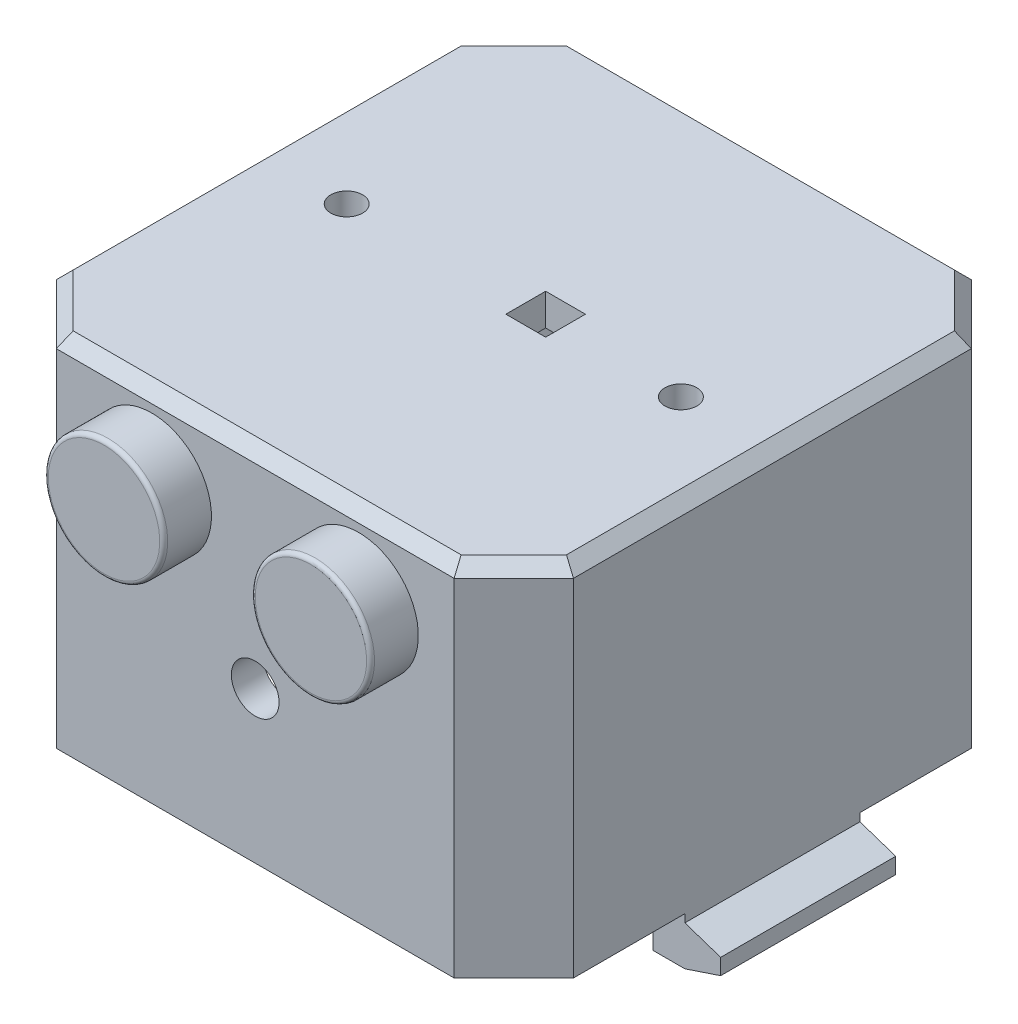
from build123d import *

# Parameters (mm, degrees)
SALIENTE_EXTRUIR1_DEPTH  = 45
VACIADO2_T               = -4
CHAFL_N3_SIZE            = 1.5
CROQUIS2_R               = 7.5
SALIENTE_EXTRUIR2_DEPTH  = 6
CROQUIS4_R               = 5
CORTAR_EXTRUIR2_DEPTH    = 8
REDONDEO1_R              = 0.5
CROQUIS5_R               = 3
CORTAR_EXTRUIR3_DEPTH    = 10
SALIENTE_EXTRUIR8_START  = 8
CROQUIS13_R              = 5
CROQUIS13_R_2            = 2.6
SALIENTE_EXTRUIR8_DEPTH  = 8
CROQUIS7_W               = 5
CROQUIS7_H               = 5
SALIENTE_EXTRUIR3_DEPTH  = 1
CROQUIS8_R               = 2.5
SALIENTE_EXTRUIR4_DEPTH  = 1
CROQUIS9_R               = 1.6
CORTAR_EXTRUIR5_DEPTH    = 4
CROQUIS12_R              = 1.15
CROQUIS12_R_2            = 0.8
SALIENTE_EXTRUIR7_DEPTH  = 6
CROQUIS14_W              = 3
CROQUIS14_H              = 2.5
SALIENTE_EXTRUIR9_DEPTH  = 5
CROQUIS15_W              = 12
CROQUIS15_H              = 8
CORTAR_EXTRUIR6_DEPTH    = 7
CROQUIS16_W              = 14.5
CROQUIS16_H              = 14.5
CROQUIS16_W_2            = 12.4
CROQUIS16_H_2            = 12.4
SALIENTE_EXTRUIR10_DEPTH = 3
CROQUIS17_R              = 5.5
CORTAR_EXTRUIR7_DEPTH    = 88.007183611
CROQUIS18_W              = 4
CROQUIS18_H              = 22
SALIENTE_EXTRUIR11_DEPTH = 6
SALIENTE_EXTRUIR13_DEPTH = 22
CROQUIS20_W              = 5
CROQUIS20_H              = 5
CORTAR_EXTRUIR8_DEPTH    = 10
CROQUIS10_R              = 2
CORTAR_EXTRUIR10_DEPTH   = 74.839352652
CORTAR_EXTRUIR11_START   = -5
CROQUIS21_R              = 0.8
CORTAR_EXTRUIR11_DEPTH   = 5


with BuildPart() as part:
    # Croquis1 → Saliente-Extruir1 (new body)
    with BuildSketch(Plane(origin=(0, 0, 0), x_dir=(1, 0, 0), z_dir=(0, 1, 0))):
        Polygon((-25, -32.5), (25, -32.5), (32.5, -25), (32.5, 25), (25, 32.5), (-25, 32.5), (-32.5, 25), (-32.5, -25), align=None)
    extrude(amount=SALIENTE_EXTRUIR1_DEPTH)

    # Vaciado2
    vaciado2_openings = [part.faces().sort_by_distance(p)[0] for p in [
        (0, 0, 0),
    ]]
    offset(amount=VACIADO2_T, openings=vaciado2_openings, kind=Kind.INTERSECTION)

    # Chaflán3
    chafl_n3_edges = [part.edges().sort_by_distance(p)[0] for p in [
        (0, 45, -32.5),
        (32.5, 45, 0),
        (0, 45, 32.5),
        (-32.5, 45, 0),
        (-28.75, 45, 28.75),
        (28.75, 45, 28.75),
        (28.75, 45, -28.75),
        (-28.75, 45, -28.75),
    ]]
    chamfer(chafl_n3_edges, length=CHAFL_N3_SIZE)

    # Croquis2 → Saliente-Extruir2 (add)
    with BuildSketch(Plane.XY.offset(32.5)):
        with Locations((13, 35)):
            Circle(CROQUIS2_R)
        with Locations((-13, 35)):
            Circle(CROQUIS2_R)
    extrude(amount=SALIENTE_EXTRUIR2_DEPTH)

    # Croquis4 → Cortar-Extruir2 (cut)
    with BuildSketch(Plane(origin=(0, 0, 28.5), x_dir=(-1, 0, 0), z_dir=(0, 0, -1))):
        with Locations((-13, 35)):
            Circle(CROQUIS4_R)
        with Locations((13, 35)):
            Circle(CROQUIS4_R)
    extrude(amount=-CORTAR_EXTRUIR2_DEPTH, mode=Mode.SUBTRACT)

    # Redondeo1
    redondeo1_edges = [part.edges().sort_by_distance(p)[0] for p in [
        (-20.5, 35, 38.5),
        (5.5, 35, 38.5),
    ]]
    fillet(redondeo1_edges, radius=REDONDEO1_R)

    # Croquis5 → Cortar-Extruir3 (cut)
    with BuildSketch(Plane.XY.offset(32.5)):
        with Locations((0, 19)):
            Circle(CROQUIS5_R)
    extrude(amount=-CORTAR_EXTRUIR3_DEPTH, mode=Mode.SUBTRACT)

    # Croquis13 → Saliente-Extruir8 (add)
    # profile 1 of 2: a face of its own
    with BuildSketch(Plane(origin=(0, 0, 36.5), x_dir=(-1, 0, 0), z_dir=(0, 0, -1)).offset(SALIENTE_EXTRUIR8_START)):
        with Locations((13, 35)):
            Circle(CROQUIS13_R)
        with Locations((13, 35)):
            Circle(CROQUIS13_R_2, mode=Mode.SUBTRACT)
    # profile 2 of 2: a face of its own
    with BuildSketch(Plane(origin=(0, 0, 36.5), x_dir=(-1, 0, 0), z_dir=(0, 0, -1)).offset(SALIENTE_EXTRUIR8_START)):
        with Locations((-13, 35)):
            Circle(CROQUIS13_R)
        with Locations((-13, 35)):
            Circle(CROQUIS13_R_2, mode=Mode.SUBTRACT)
    extrude(amount=-SALIENTE_EXTRUIR8_DEPTH)

    # Croquis7 → Saliente-Extruir3 (add)
    with BuildSketch(Plane(origin=(0, 0, 28.5), x_dir=(-1, 0, 0), z_dir=(0, 0, -1))):
        with Locations((-11.58, 10.5)):
            Rectangle(CROQUIS7_W, CROQUIS7_H)
        with Locations((-11.58, 28)):
            Rectangle(CROQUIS7_W, CROQUIS7_H)
        with Locations((11.43, 10.5)):
            Rectangle(CROQUIS7_W, CROQUIS7_H)
        with Locations((11.43, 28)):
            Rectangle(CROQUIS7_W, CROQUIS7_H)
    extrude(amount=SALIENTE_EXTRUIR3_DEPTH)

    # Croquis8 → Saliente-Extruir4 (add)
    with BuildSketch(Plane(origin=(0, 0, 27.5), x_dir=(-1, 0, 0), z_dir=(0, 0, -1))):
        with Locations((-11.505, 10.489346828)):
            Circle(CROQUIS8_R)
        with Locations((-11.505, 27.976317365)):
            Circle(CROQUIS8_R)
        with Locations((11.505, 10.489346828)):
            Circle(CROQUIS8_R)
        with Locations((11.505, 27.976317365)):
            Circle(CROQUIS8_R)
    extrude(amount=SALIENTE_EXTRUIR4_DEPTH)

    # Croquis9 → Cortar-Extruir5 (cut)
    with BuildSketch(Plane(origin=(0, 0, 26.5), x_dir=(-1, 0, 0), z_dir=(0, 0, -1))):
        with Locations((-11.505, 27.976317365)):
            Circle(CROQUIS9_R)
        with Locations((-11.505, 10.489346828)):
            Circle(CROQUIS9_R)
        with Locations((11.505, 10.489346828)):
            Circle(CROQUIS9_R)
        with Locations((11.505, 27.976317365)):
            Circle(CROQUIS9_R)
    extrude(amount=-CORTAR_EXTRUIR5_DEPTH, mode=Mode.SUBTRACT)

    # Croquis12 → Saliente-Extruir7 (add)
    # profile 1 of 4: a face of its own
    with BuildSketch(Plane.XZ.offset(-41)):
        with Locations((-20.65, 7.68)):
            Circle(CROQUIS12_R)
        with Locations((-20.65, 7.68)):
            Circle(CROQUIS12_R_2, mode=Mode.SUBTRACT)
    # profile 2 of 4: a face of its own
    with BuildSketch(Plane.XZ.offset(-41)):
        with Locations((-20.65, -7.68)):
            Circle(CROQUIS12_R)
        with Locations((-20.65, -7.68)):
            Circle(CROQUIS12_R_2, mode=Mode.SUBTRACT)
    # profile 3 of 4: a face of its own
    with BuildSketch(Plane.XZ.offset(-41)):
        with Locations((20.65, 7.68)):
            Circle(CROQUIS12_R)
        with Locations((20.65, 7.68)):
            Circle(CROQUIS12_R_2, mode=Mode.SUBTRACT)
    # profile 4 of 4: a face of its own
    with BuildSketch(Plane.XZ.offset(-41)):
        with Locations((20.65, -7.68)):
            Circle(CROQUIS12_R)
        with Locations((20.65, -7.68)):
            Circle(CROQUIS12_R_2, mode=Mode.SUBTRACT)
    extrude(amount=SALIENTE_EXTRUIR7_DEPTH)

    # Croquis14 → Saliente-Extruir9 (add)
    with BuildSketch(Plane.XZ.offset(-41)):
        with Locations((-20.65, 7.68)):
            Rectangle(CROQUIS14_W, CROQUIS14_H)
        with Locations((-20.65, -7.68)):
            Rectangle(CROQUIS14_W, CROQUIS14_H)
        with Locations((20.65, 7.68)):
            Rectangle(CROQUIS14_W, CROQUIS14_H)
        with Locations((20.65, -7.68)):
            Rectangle(CROQUIS14_W, CROQUIS14_H)
    extrude(amount=SALIENTE_EXTRUIR9_DEPTH)

    # Croquis15 → Cortar-Extruir6 (cut)
    with BuildSketch(Plane.ZY.offset(32.5)):
        with Locations((0, 36.5)):
            Rectangle(CROQUIS15_W, CROQUIS15_H)
    extrude(amount=-CORTAR_EXTRUIR6_DEPTH, mode=Mode.SUBTRACT)

    # Croquis16 → Saliente-Extruir10 (add)
    with BuildSketch(Plane.XY.offset(-28.5)):
        with Locations((12.75, 12.25)):
            Rectangle(CROQUIS16_W, CROQUIS16_H)
        with Locations((12.75, 12.25)):
            Rectangle(CROQUIS16_W_2, CROQUIS16_H_2, mode=Mode.SUBTRACT)
    extrude(amount=SALIENTE_EXTRUIR10_DEPTH)

    # Croquis17 → Cortar-Extruir7 (cut, through all)
    with BuildSketch(Plane.XY.offset(-28.5)):
        with Locations((12.75, 12.25)):
            Circle(CROQUIS17_R)
    extrude(amount=-CORTAR_EXTRUIR7_DEPTH, mode=Mode.SUBTRACT)

    # Croquis18 → Saliente-Extruir11 (add)
    with BuildSketch(Plane.XZ):
        with Locations((-30.5, 0)):
            Rectangle(CROQUIS18_W, CROQUIS18_H)
        with Locations((30.5, 0)):
            Rectangle(CROQUIS18_W, CROQUIS18_H)
    extrude(amount=SALIENTE_EXTRUIR11_DEPTH)

    # Croquis19 → Saliente-Extruir13 (add)
    with BuildSketch(Plane.XY.offset(11)):
        Polygon((-32.5, -1), (-37, -2.5), (-37, -4.5), (-32.5, -6), align=None)
        Polygon((32.5, -1), (32.5, -6), (37, -4.5), (37, -2.5), align=None)
    extrude(amount=-SALIENTE_EXTRUIR13_DEPTH)

    # Croquis20 → Cortar-Extruir8 (cut)
    with BuildSketch(Plane(origin=(0, 45, 0), x_dir=(1, 0, 0), z_dir=(0, 1, 0))):
        with Locations((3.50287975, 0.5)):
            Rectangle(CROQUIS20_W, CROQUIS20_H)
    extrude(amount=-CORTAR_EXTRUIR8_DEPTH, mode=Mode.SUBTRACT)

    # Croquis10 → Cortar-Extruir10 (cut, through all)
    with BuildSketch(Plane(origin=(0, 45, 0), x_dir=(1, 0, 0), z_dir=(0, 1, 0))):
        with Locations((-21, 0)):
            Circle(CROQUIS10_R)
        with Locations((21, 0)):
            Circle(CROQUIS10_R)
    extrude(amount=-CORTAR_EXTRUIR10_DEPTH, mode=Mode.SUBTRACT)

    # Croquis21 → Cortar-Extruir11 (cut)
    with BuildSketch(Plane.XZ.offset(-36).offset(CORTAR_EXTRUIR11_START)):
        with Locations((-20.65, 7.68)):
            Circle(CROQUIS21_R)
        with Locations((20.65, 7.68)):
            Circle(CROQUIS21_R)
        with Locations((20.65, -7.68)):
            Circle(CROQUIS21_R)
        with Locations((-20.65, -7.68)):
            Circle(CROQUIS21_R)
    extrude(amount=CORTAR_EXTRUIR11_DEPTH, mode=Mode.SUBTRACT)


solid = part.part
